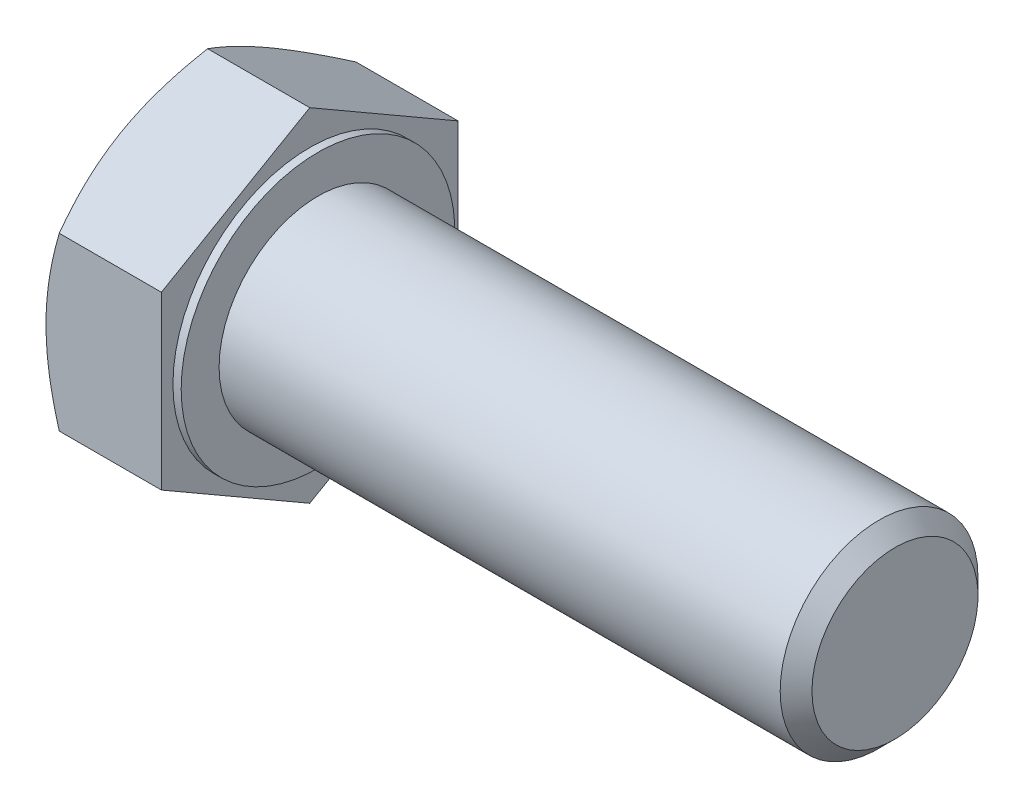
from build123d import *

# Parameters (mm, degrees)
BASEHEAD_DEPTH = 7.5
SKETCH4_W      = 0.5
SKETCH4_H      = 12.092304845


# Read off the part's stored shape, not the designer's step: HeadChamfer
with BuildPart() as part:
    # Sketch1 → BaseHead (new body)
    with BuildSketch(Plane(origin=(0, 0, 0), x_dir=(0, 0, -1), z_dir=(1, 0, 0))):
        Polygon((9, 5.196152423), (9, -5.196152423), (0, -10.392304845), (-9, -5.196152423), (-9, 5.196152423), (0, 10.392304845), align=None)
    extrude(amount=BASEHEAD_DEPTH)

    # HeadChamfer outline → HeadChamfer (revolve, cut)
    with BuildSketch(Plane.YX):
        Polygon((10.392304847, 0.803847578), (9, 0), (10.392304847, 0), align=None)
    revolve(axis=Axis((0, 0, 0), (1, 0, 0)), mode=Mode.SUBTRACT)

    # HeadChamfer 2 outline → HeadChamfer 2 (revolve)
    with BuildSketch(Plane.YX):
        Polygon((6, 7.5), (6, 41.536), (5.036, 42.5), (0, 42.5), (0, 7.5), align=None)
    revolve(axis=Axis((0, 0, 0), (1, 0, 0)))

    # Sketch4 → BearingFace (revolve, cut)
    with BuildSketch(Plane.XY, mode=Mode.PRIVATE) as bearingface_sk:
        with Locations((7.25, 14.346152423)):
            Rectangle(SKETCH4_W, SKETCH4_H)
    revolve(bearingface_sk.sketch.rotate(Axis((0, 0, 0), (1, 0, 0)), 90), axis=Axis((0, 0, 0), (1, 0, 0)), mode=Mode.SUBTRACT)


solid = part.part
